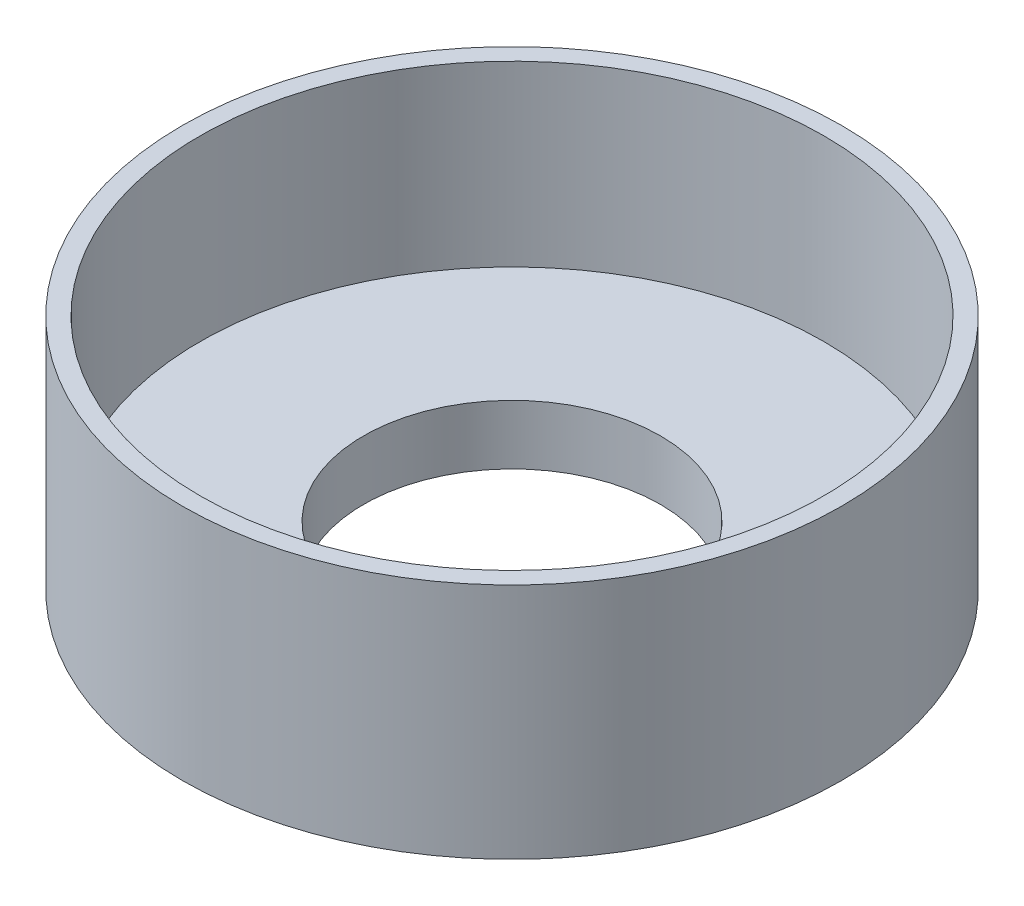
from build123d import *

# Parameters (mm, degrees)
SKETCH1_R           = 11.1
SKETCH1_R_2         = 5
BOSS_EXTRUDE1_DEPTH = 2
SKETCH2_R           = 11.1
SKETCH2_R_2         = 10.5
BOSS_EXTRUDE2_DEPTH = 6


with BuildPart() as part:
    # Sketch1 → Boss-Extrude1 (new body)
    with BuildSketch(Plane(origin=(0, 0, 0), x_dir=(1, 0, 0), z_dir=(0, 1, 0))):
        Circle(SKETCH1_R)
        Circle(SKETCH1_R_2, mode=Mode.SUBTRACT)
    extrude(amount=BOSS_EXTRUDE1_DEPTH)

    # Sketch2 → Boss-Extrude2 (add)
    with BuildSketch(Plane(origin=(0, 2, 0), x_dir=(1, 0, 0), z_dir=(0, 1, 0))):
        Circle(SKETCH2_R)
        Circle(SKETCH2_R_2, mode=Mode.SUBTRACT)
    extrude(amount=BOSS_EXTRUDE2_DEPTH)


solid = part.part
